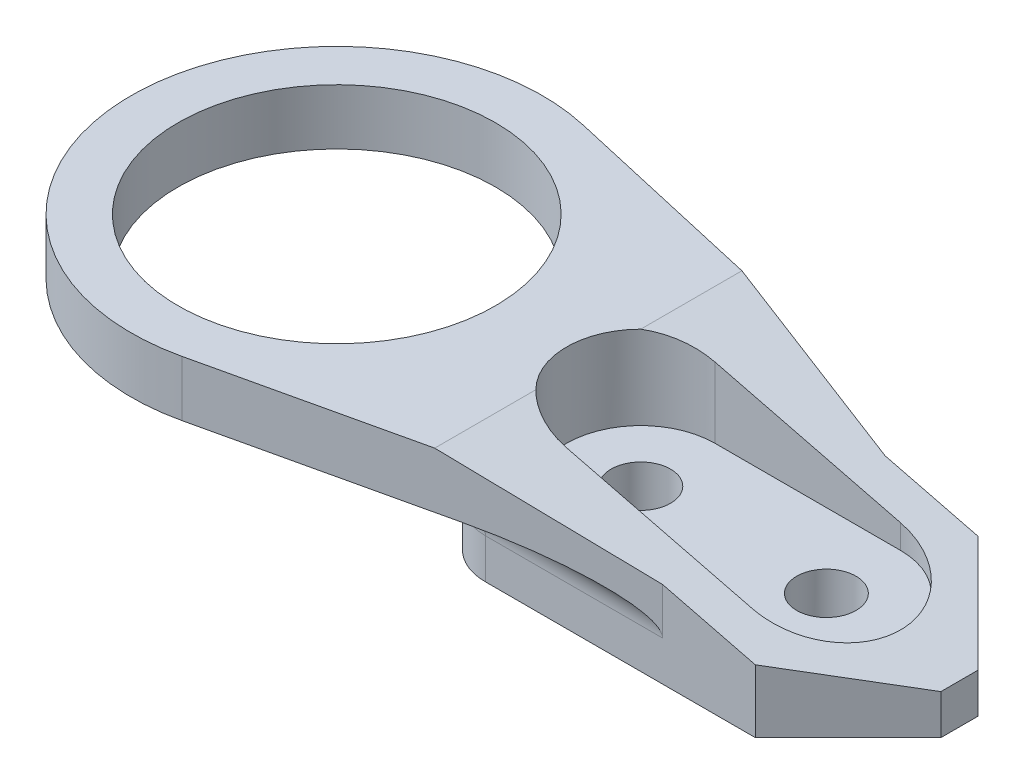
from build123d import *

# Parameters (mm, degrees)
SKETCH1_W           = 25
SKETCH1_H           = 7.15
BOSS_EXTRUDE1_DEPTH = 12
BOSS_EXTRUDE2_DEPTH = 3
SKETCH3_R           = 11
CUT_EXTRUDE1_DEPTH  = 21
FILLET1_R           = 3
SKETCH4_R           = 8.55
CUT_EXTRUDE2_DEPTH  = 10
CHAMFER1_SIZE       = 5
CHAMFER1_SIZE2      = 20
SKETCH5_W           = 1.256127395
SKETCH5_H           = 6
BOSS_EXTRUDE3_DEPTH = 5
FILLET2_R           = 2
CHAMFER2_SIZE       = 5
SKETCH6_R           = 1.6
CUT_EXTRUDE3_DEPTH  = 10
CUT_EXTRUDE4_DEPTH  = 4.5


with BuildPart() as part:
    # Sketch1 → Boss-Extrude1 (new body)
    with BuildSketch(Plane.XY):
        with Locations((12.5, 3.575)):
            Rectangle(SKETCH1_W, SKETCH1_H)
    extrude(amount=BOSS_EXTRUDE1_DEPTH)

    # Sketch2 → Boss-Extrude2 (add)
    with BuildSketch(Plane(origin=(0, 7.15, 0), x_dir=(1, 0, 0), z_dir=(0, 1, 0))):
        with BuildLine():
            Line((0, 0), (15, 0))
            Line((15, 0), (-6.093725322, 4.80327375))
            ThreePointArc((-6.093725322, 4.80327375), (-19.63357132, -6), (-6.093725322, -16.80327375))
            Line((-6.093725322, -16.80327375), (15, -12))
            Line((15, -12), (0, -12))
            Line((0, -12), (0, 0))
        make_face()
    extrude(amount=-BOSS_EXTRUDE2_DEPTH)

    # Sketch3 → Cut-Extrude1 (cut)
    with BuildSketch(Plane.XZ.offset(-4.15)):
        with Locations((-8.220106634, 6)):
            Circle(SKETCH3_R)
    extrude(amount=CUT_EXTRUDE1_DEPTH, mode=Mode.SUBTRACT)

    # Fillet1
    fillet1_edges = [part.edges().sort_by_distance(p)[0] for p in [
        (0.999437824, 2.075, 0),
        (0.999437824, 2.075, 12),
    ]]
    fillet(fillet1_edges, radius=FILLET1_R)

    # Sketch4 → Cut-Extrude2 (cut)
    with BuildSketch(Plane.XZ.offset(-4.15)):
        with Locations((-8.553749828, 6)):
            Circle(SKETCH4_R)
    extrude(amount=-CUT_EXTRUDE2_DEPTH, mode=Mode.SUBTRACT)

    # Chamfer1
    chamfer1_edges = [part.edges().sort_by_distance(p)[0] for p in [
        (25, 7.15, 6),
    ]]
    chamfer1_side = [part.faces().sort_by_distance(p)[0] for p in [
        (25, 3.575, 6),
    ]]
    chamfer(chamfer1_edges, length=CHAMFER1_SIZE, length2=CHAMFER1_SIZE2, reference=chamfer1_side[0])

    # Sketch5 → Boss-Extrude3 (add)
    with BuildSketch(Plane(origin=(0, 0, 0), x_dir=(-1, 0, 0), z_dir=(0, -1, 0))):
        with Locations((-3.082751396, -6)):
            Rectangle(SKETCH5_W, SKETCH5_H)
    extrude(amount=-BOSS_EXTRUDE3_DEPTH)

    # Fillet2
    fillet2_edges = [part.edges().sort_by_distance(p)[0] for p in [
        (10.227343849, 4.15, 0),
        (10.227343849, 4.15, 12),
        (3.333367354, 4.15, 11.121320344),
        (2.454687698, 4.15, 6),
        (3.333367354, 4.15, 0.878679656),
    ]]
    fillet(fillet2_edges, radius=FILLET2_R)

    # Chamfer2
    chamfer2_edges = [part.edges().sort_by_distance(p)[0] for p in [
        (25, 1.075, 12),
        (25, 1.075, 0),
    ]]
    chamfer(chamfer2_edges, length=CHAMFER2_SIZE)

    # Sketch6 → Cut-Extrude3 (cut)
    with BuildSketch(Plane(origin=(0, 7.15, 0), x_dir=(1, 0, 0), z_dir=(0, 1, 0))):
        with Locations((7.829893366, -6)):
            Circle(SKETCH6_R)
        with Locations((17.829893366, -6)):
            Circle(SKETCH6_R)
    extrude(amount=-CUT_EXTRUDE3_DEPTH, mode=Mode.SUBTRACT)

    # Sketch7 → Cut-Extrude4 (cut)
    with BuildSketch(Plane(origin=(0, 7.15, 0), x_dir=(1, 0, 0), z_dir=(0, 1, 0))):
        with BuildLine():
            Line((7.829893366, -2), (17.829893366, -2))
            ThreePointArc((17.829893366, -2), (21.829893366, -6), (17.829893366, -10))
            Line((17.829893366, -10), (7.829893366, -10))
            ThreePointArc((7.829893366, -10), (3.829893366, -6), (7.829893366, -2))
        make_face()
    extrude(amount=-CUT_EXTRUDE4_DEPTH, mode=Mode.SUBTRACT)


solid = part.part
